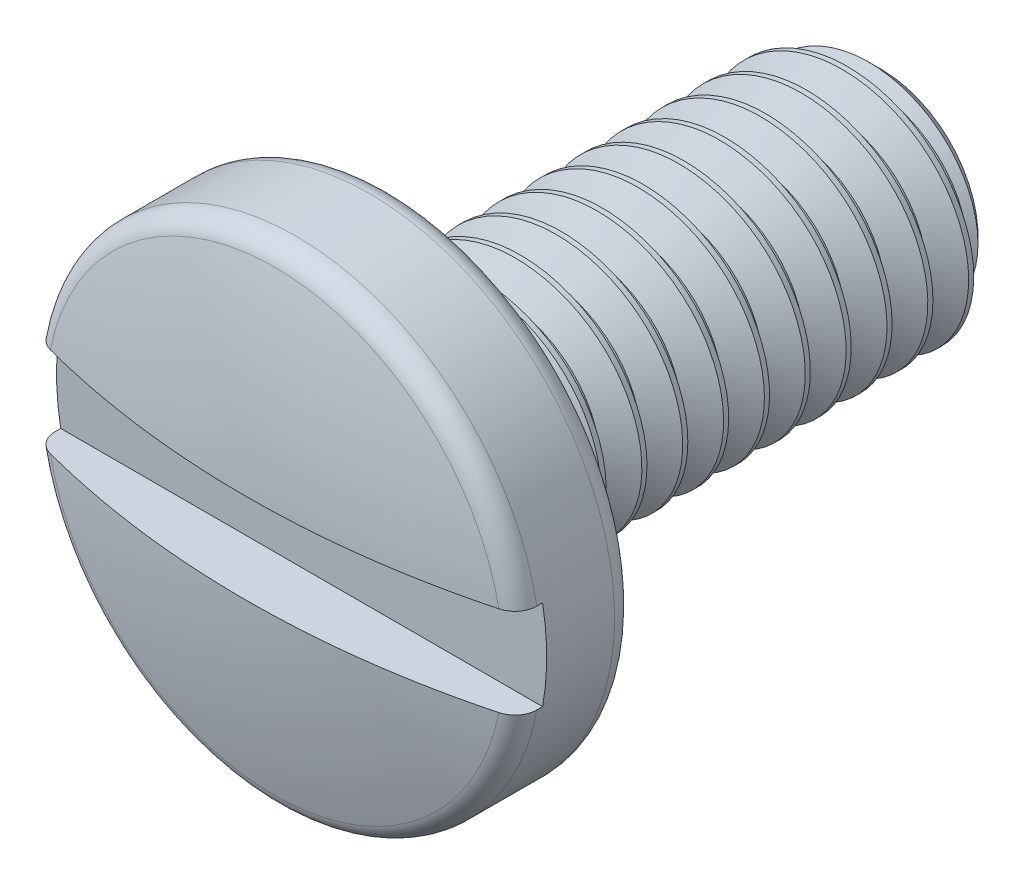
from build123d import *

# Parameters (mm, degrees)
CUT_EXTRUDE1_DEPTH      = 6.762811918
CUT_EXTRUDE1_DEPTH_BACK = 6.762811918
SKETCH4_W               = 0.7
SKETCH4_H               = 1.1
CUT_SWEEP1_PITCH        = 0.5
SKETCH7_R               = 1.554126588
BOSS_EXTRUDE1_DEPTH     = 1.1


with BuildPart() as part:
    # Sketch3 → Revolve1 (revolve)
    with BuildSketch(Plane(origin=(0, 0, 0), x_dir=(0, 0, -1), z_dir=(1, 0, 0))):
        with BuildLine():
            Line((3.9, 0), (-3.9, 0))
            ThreePointArc((-3.9, 0), (-3.807294745, 1.412115791), (-3.530770326, 2.799991691))
            ThreePointArc((-3.530770326, 2.799991691), (-3.43432018, 2.944240235), (-3.27, 3))
            Line((-3.27, 3), (-2.37, 3))
            ThreePointArc((-2.37, 3), (-2.179081169, 2.920918831), (-2.1, 2.73))
            Line((-2.1, 2.73), (-2.1, 1.5))
            Line((-2.1, 1.5), (3.579126588, 1.5))
            Line((3.579126588, 1.5), (3.9, 1.179126588))
            Line((3.9, 1.179126588), (3.9, 0))
        make_face()
    revolve(axis=Axis((0, 0, -3.9), (0, 0, 1)))

    # Sketch4 → Cut-Extrude1 (cut, two sides: drawn at the far end of the back side and taken through both)
    with BuildSketch(Plane(origin=(0, 0, 0), x_dir=(0, 0, -1), z_dir=(1, 0, 0)).offset(-CUT_EXTRUDE1_DEPTH_BACK)):
        with Locations((-3.55, 0)):
            Rectangle(SKETCH4_W, SKETCH4_H)
    extrude(amount=CUT_EXTRUDE1_DEPTH + CUT_EXTRUDE1_DEPTH_BACK, mode=Mode.SUBTRACT)

    # Cut-Sweep1: arcs per turn and ends read off the stored shape
    # Cut-Sweep1: the profile of Sketch6 screwed along a right-hand helix through 13 turns, 6 arcs to a turn; built about Z, then put on its axis
    cut_sweep1_z = Axis((0, 0, 0), (0, 0, 1))
    cut_sweep1_corners = [(1.175240474, 0, -0.1875), (1.175240474, 0, -0.25), (1.527063294, 0, -0.453125), (1.527063294, 0, 0.015625)]
    with BuildLine(mode=Mode.PRIVATE) as cut_sweep1_profile:
        Line(cut_sweep1_corners[0], cut_sweep1_corners[1])
        Line(cut_sweep1_corners[1], cut_sweep1_corners[2])
        Line(cut_sweep1_corners[2], cut_sweep1_corners[3])
        Line(cut_sweep1_corners[3], cut_sweep1_corners[0])
    cut_sweep1_cap = Face(cut_sweep1_profile.wire())
    cut_sweep1_turn_angles = [0, 30, 60, 90, 120, 150, 180, 210, 240, 270, 300, 330, 360]
    cut_sweep1_turn_weights = [1, 0.8660254037844387, 1, 0.8660254037844387, 1, 0.8660254037844387, 1, 0.8660254037844387, 1, 0.8660254037844387, 1, 0.8660254037844387, 1]
    cut_sweep1_turn_rails = [Edge.make_bspline([Vector(p[0], p[1], 0).rotate(cut_sweep1_z, cut_sweep1_turn_angles[k]) / cut_sweep1_turn_weights[k] + Vector(0, 0, p[2] + CUT_SWEEP1_PITCH * cut_sweep1_turn_angles[k] / 360) for k in range(13)], [0, 0, 0, 1, 1, 2, 2, 3, 3, 4, 4, 5, 5, 6, 6, 6], 2, cut_sweep1_turn_weights) for p in cut_sweep1_corners]
    cut_sweep1_turn_sides = [Face.make_surface_from_curves(cut_sweep1_turn_rails[p[0]], cut_sweep1_turn_rails[p[1]]) for p in [(0, 1), (1, 2), (2, 3), (3, 0)]]
    cut_sweep1 = Plane(origin=(0, 0, -3.9), x_dir=(0, 1, 0), z_dir=(0, 0, 1)) * Solid(Shell([*[p.moved(Location((0, 0, CUT_SWEEP1_PITCH * i))) for i in range(13) for p in cut_sweep1_turn_sides], cut_sweep1_cap, cut_sweep1_cap.rotate(cut_sweep1_z, 4680).moved(Location((0, 0, CUT_SWEEP1_PITCH * 4680 / 360)))]))
    add(cut_sweep1, mode=Mode.SUBTRACT)

    # Sketch7 → Boss-Extrude1 (add)
    with BuildSketch(Plane.XY.offset(2.1)):
        Circle(SKETCH7_R)
    extrude(amount=BOSS_EXTRUDE1_DEPTH)

    # Boss-Extrude1 cone 1 section (through the dimple's axis) → Boss-Extrude1 other way (revolve)
    with BuildSketch(Plane(origin=(0, 0, 2.1), x_dir=(0, -1, 0), z_dir=(1, 0, 0))):
        Polygon((0, 0), (1.554126588, 0), (0, 1.554126588), align=None)
    revolve(axis=Axis((0, 0, 2.1), (0, 0, -1)))


solid = part.part
